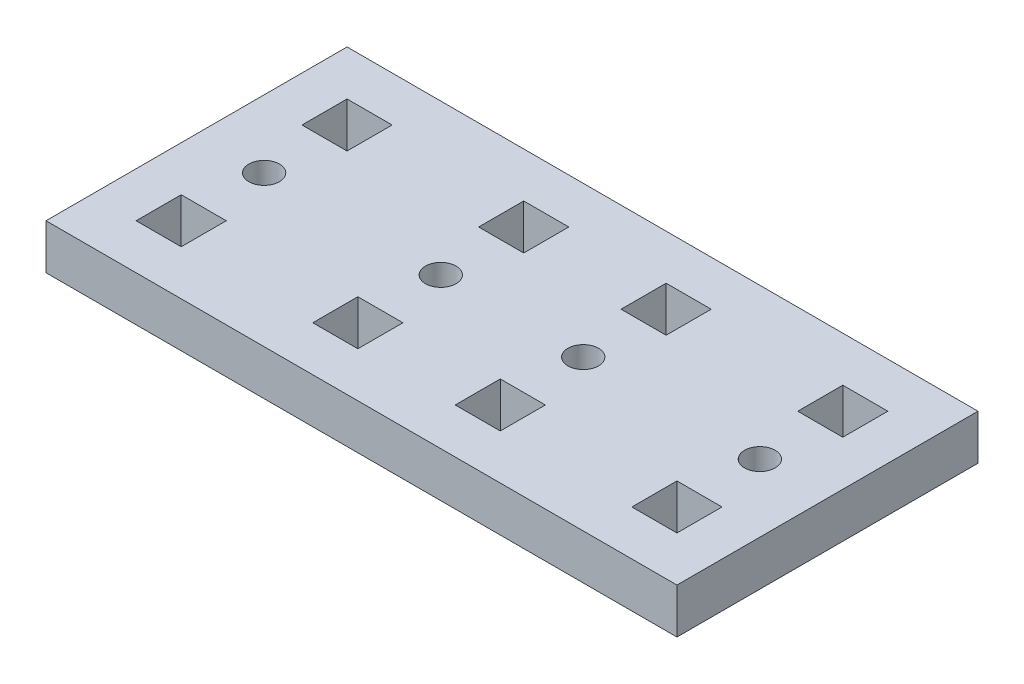
from build123d import *

# Parameters (mm, degrees)
ELEVATOR_SPACER_W   = 88.9
ELEVATOR_SPACER_H   = 42.418
ELEVATOR_SPACER_R   = 2.159
ELEVATOR_SPACER_W_2 = 6.35
ELEVATOR_SPACER_H_2 = 6.35
BOSS_EXTRUDE1_DEPTH = 6.35


with BuildPart() as part:
    # Elevator Spacer → Boss-Extrude1 (new body)
    with BuildSketch(Plane(origin=(0, 0, 0), x_dir=(1, 0, 0), z_dir=(0, 1, 0))):
        Rectangle(ELEVATOR_SPACER_W, ELEVATOR_SPACER_H)
        with Locations((34.925, 0)):
            Circle(ELEVATOR_SPACER_R, mode=Mode.SUBTRACT)
        with Locations((10.033, 0)):
            Circle(ELEVATOR_SPACER_R, mode=Mode.SUBTRACT)
        with Locations((-10.033, 0)):
            Circle(ELEVATOR_SPACER_R, mode=Mode.SUBTRACT)
        with Locations((-34.925, 0)):
            Circle(ELEVATOR_SPACER_R, mode=Mode.SUBTRACT)
        with Locations((34.925, 11.684)):
            Rectangle(ELEVATOR_SPACER_W_2, ELEVATOR_SPACER_H_2, mode=Mode.SUBTRACT)
        with Locations((34.925, -11.684)):
            Rectangle(ELEVATOR_SPACER_W_2, ELEVATOR_SPACER_H_2, mode=Mode.SUBTRACT)
        with Locations((10.033, 11.684)):
            Rectangle(ELEVATOR_SPACER_W_2, ELEVATOR_SPACER_H_2, mode=Mode.SUBTRACT)
        with Locations((10.033, -11.684)):
            Rectangle(ELEVATOR_SPACER_W_2, ELEVATOR_SPACER_H_2, mode=Mode.SUBTRACT)
        with Locations((-10.033, -11.684)):
            Rectangle(ELEVATOR_SPACER_W_2, ELEVATOR_SPACER_H_2, mode=Mode.SUBTRACT)
        with Locations((-10.033, 11.684)):
            Rectangle(ELEVATOR_SPACER_W_2, ELEVATOR_SPACER_H_2, mode=Mode.SUBTRACT)
        with Locations((-34.925, -11.684)):
            Rectangle(ELEVATOR_SPACER_W_2, ELEVATOR_SPACER_H_2, mode=Mode.SUBTRACT)
        with Locations((-34.925, 11.684)):
            Rectangle(ELEVATOR_SPACER_W_2, ELEVATOR_SPACER_H_2, mode=Mode.SUBTRACT)
    extrude(amount=BOSS_EXTRUDE1_DEPTH)


solid = part.part
